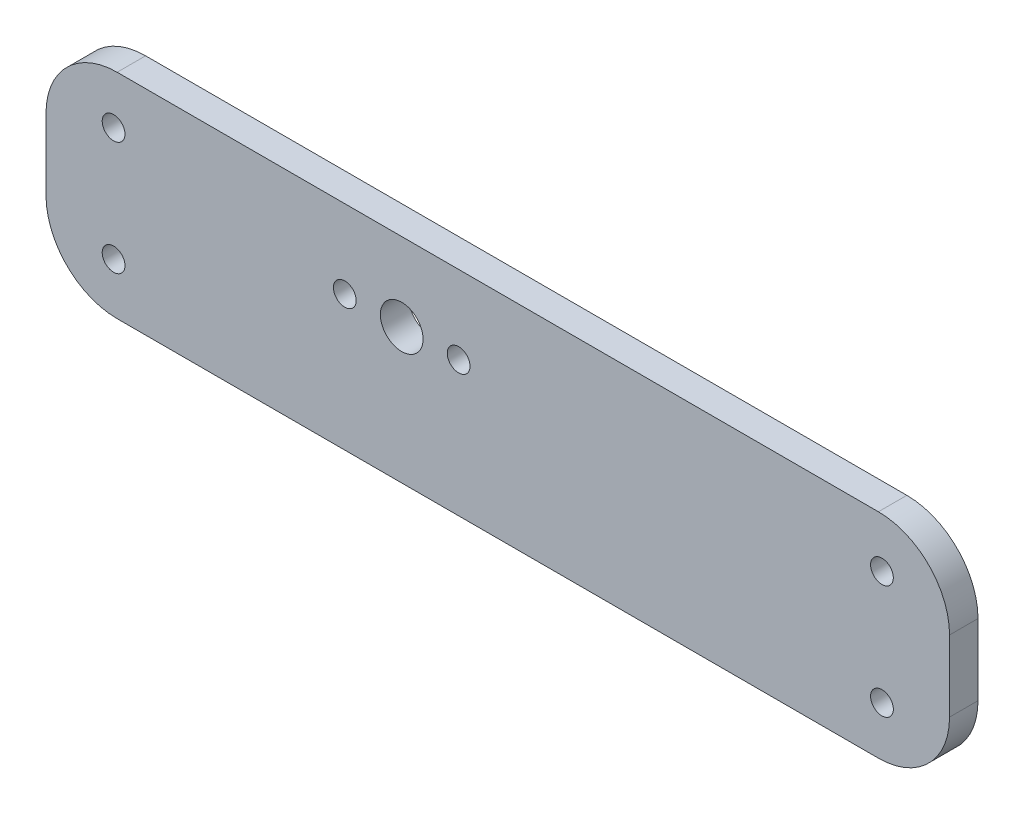
from build123d import *

# Parameters (mm, degrees)
ESBO_O1_W                = 127
ESBO_O1_H                = 30
ESBO_O1_R                = 3
ESBO_O1_R_2              = 1.6
RESSALTO_EXTRUS_O1_DEPTH = 4
FILETE1_R                = 10


with BuildPart() as part:
    # Esboço1 → Ressalto-extrusão1 (new body)
    with BuildSketch(Plane.XY):
        Rectangle(ESBO_O1_W, ESBO_O1_H)
        with Locations((-13.5, 4)):
            Circle(ESBO_O1_R, mode=Mode.SUBTRACT)
        with Locations((-5.5, 4)):
            Circle(ESBO_O1_R_2, mode=Mode.SUBTRACT)
        with Locations((-21.5, 4)):
            Circle(ESBO_O1_R_2, mode=Mode.SUBTRACT)
        with Locations((-54, 8)):
            Circle(ESBO_O1_R_2, mode=Mode.SUBTRACT)
        with Locations((-54, -8)):
            Circle(ESBO_O1_R_2, mode=Mode.SUBTRACT)
        with Locations((54, -8)):
            Circle(ESBO_O1_R_2, mode=Mode.SUBTRACT)
        with Locations((54, 8)):
            Circle(ESBO_O1_R_2, mode=Mode.SUBTRACT)
    extrude(amount=RESSALTO_EXTRUS_O1_DEPTH)

    # Filete1
    filete1_edges = [part.edges().sort_by_distance(p)[0] for p in [
        (-63.5, 15, 2),
        (-63.5, -15, 2),
        (63.5, -15, 2),
        (63.5, 15, 2),
    ]]
    fillet(filete1_edges, radius=FILETE1_R)


solid = part.part
